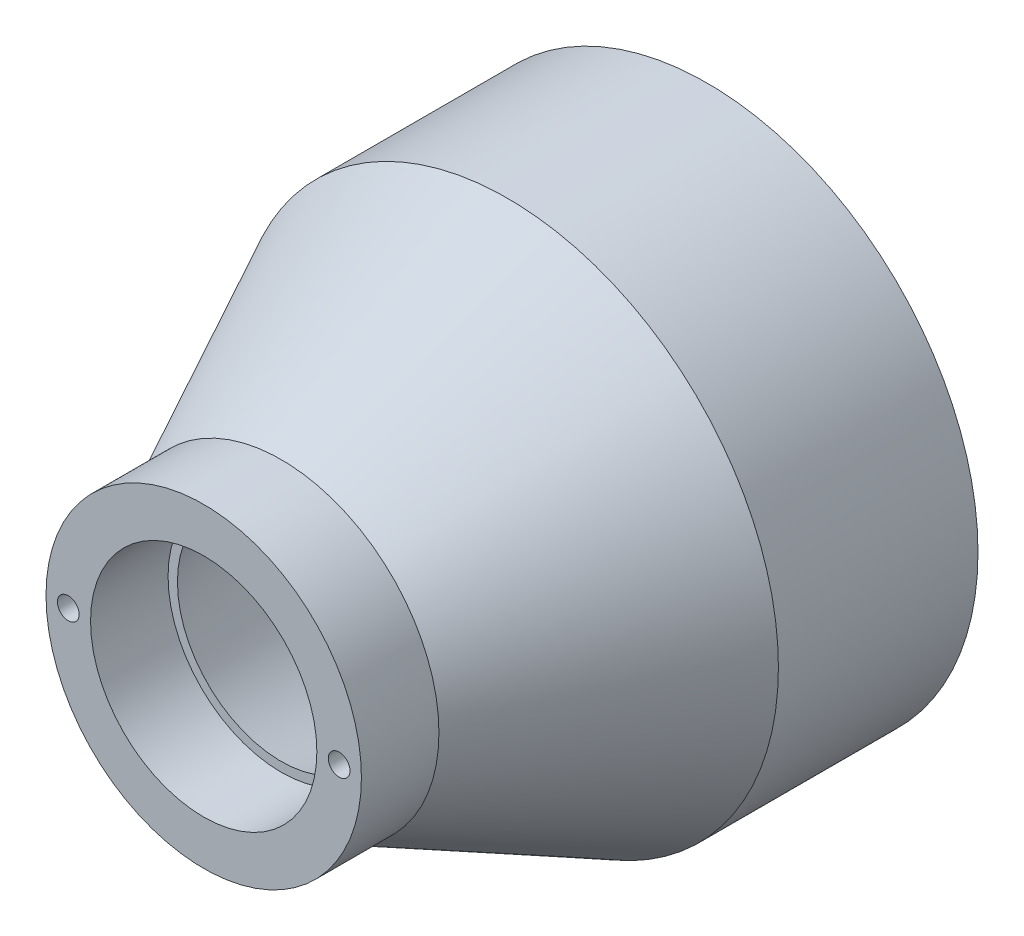
from build123d import *

# Parameters (mm, degrees)
ESQUISSE1_R                     = 17.7
ESQUISSE1_R_2                   = 12.7
BOSS_EXTRU_1_DEPTH              = 8.7
ESQUISSE2_R                     = 30.4
ESQUISSE2_R_2                   = 11.2
BOSS_EXTRU_2_DEPTH              = 47.8
CHANFREIN1_SIZE                 = 25.4
CHANFREIN1_SIZE2                = 12.699971641
CHANFREIN3_SIZE                 = 11.200084029
CHANFREIN3_SIZE_2               = 49.8
F_41_0_096_DIAMETER_HOLE1_D     = 2.4384
F_41_0_096_DIAMETER_HOLE1_DEPTH = 5
F_41_0_096_DIAMETER_HOLE1_TIP   = 0.732569267


with BuildPart() as part:
    # Esquisse1 → Boss.-Extru.1 (new body)
    with BuildSketch(Plane.XY):
        Circle(ESQUISSE1_R)
        Circle(ESQUISSE1_R_2, mode=Mode.SUBTRACT)
    extrude(amount=BOSS_EXTRU_1_DEPTH)

    # Esquisse2 → Boss.-Extru.2 (add)
    with BuildSketch(Plane(origin=(0, 0, 0), x_dir=(-1, 0, 0), z_dir=(0, 0, -1))):
        with Locations(Location((0, 0, 0), (0, 0, 180))):
            Circle(ESQUISSE2_R)
        with Locations(Location((0, 0, 0), (0, 0, 180))):
            Circle(ESQUISSE2_R_2, mode=Mode.SUBTRACT)
    extrude(amount=BOSS_EXTRU_2_DEPTH)

    # Chanfrein1
    chanfrein1_edges = [part.edges().sort_by_distance(p)[0] for p in [
        (-30.4, 0, 0),
    ]]
    chanfrein1_side = [part.faces().sort_by_distance(p)[0] for p in [
        (-30.4, 0, -23.9),
    ]]
    chamfer(chanfrein1_edges, length=CHANFREIN1_SIZE, length2=CHANFREIN1_SIZE2, reference=chanfrein1_side[0])

    # Chanfrein3
    # the kernel refuses this chamfer: 49.8, 11.200084029 mm, written as the material it takes off along each edge
    with BuildSketch(Plane(origin=(0, 0, -47.8), x_dir=(1, 0, 0), z_dir=(0, 1, 0))) as chanfrein3_piece_1:
        Polygon((11.2 + CHANFREIN3_SIZE, 0), (11.2, -CHANFREIN3_SIZE_2), (11.2, 0), align=None)
    revolve(axis=Axis((0, 0, -47.8), (0, 0, -1)), mode=Mode.SUBTRACT)

    # #41 (0.096) Diameter Hole1
    with Locations(Plane.XY.offset(8.7)):
        with Locations((-15.2, 0), (15.2, 0)):
            Hole(F_41_0_096_DIAMETER_HOLE1_D / 2, depth=F_41_0_096_DIAMETER_HOLE1_DEPTH)
            with Locations((0, 0, -(F_41_0_096_DIAMETER_HOLE1_DEPTH + F_41_0_096_DIAMETER_HOLE1_TIP / 2))):  # 118° drill point
                Cone(0, F_41_0_096_DIAMETER_HOLE1_D / 2, F_41_0_096_DIAMETER_HOLE1_TIP, mode=Mode.SUBTRACT)


solid = part.part
